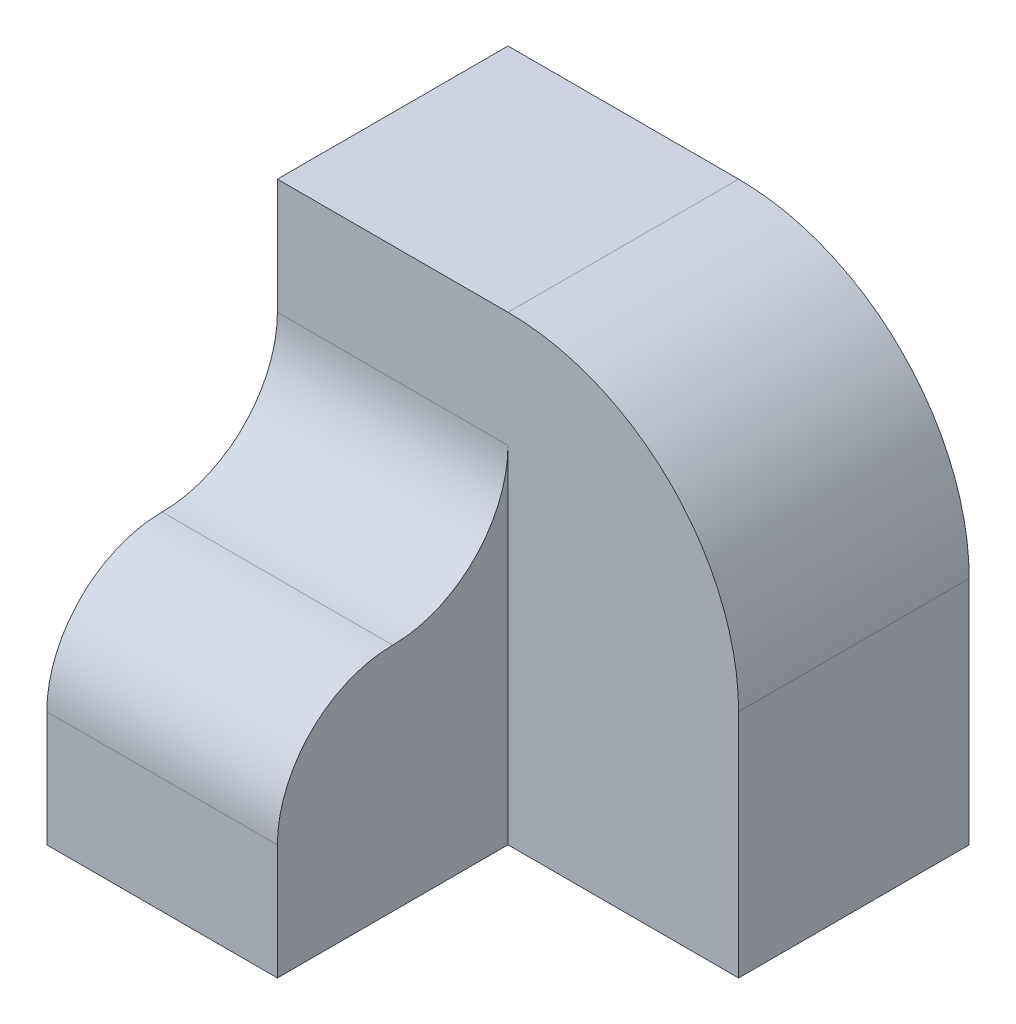
from build123d import *

# Parameters (mm, degrees)
DODANIE_WYCI_GNI_CIE1_DEPTH = 20
SZKIC2_W                    = 20
SZKIC2_H                    = 40
DODANIE_WYCI_GNI_CIE2_DEPTH = 20
WYTNIJ_WYCI_GNI_CIE1_DEPTH  = 20
ZAOKR_GLENIE1_R             = 10
ZAOKR_GLENIE2_R             = 10


with BuildPart() as part:
    # Szkic1 → Dodanie-wyciągnięcie1 (new body)
    with BuildSketch(Plane.XY):
        with BuildLine():
            Line((0, 0), (40, 0))
            Line((40, 0), (40, 20))
            ThreePointArc((40, 20), (34.142135624, 34.142135624), (20, 40))
            Line((20, 40), (0, 40))
            Line((0, 40), (0, 0))
        make_face()
    extrude(amount=DODANIE_WYCI_GNI_CIE1_DEPTH)

    # Szkic2 → Dodanie-wyciągnięcie2 (add)
    with BuildSketch(Plane.XY.offset(20)):
        with Locations((10, 20)):
            Rectangle(SZKIC2_W, SZKIC2_H)
    extrude(amount=DODANIE_WYCI_GNI_CIE2_DEPTH)

    # Szkic3 → Wytnij-wyciągnięcie1 (cut)
    with BuildSketch(Plane(origin=(20, 0, 0), x_dir=(0, 0, -1), z_dir=(1, 0, 0))):
        Polygon((-40, 20), (-30, 20), (-20, 20), (-20, 40), (-40, 40), align=None)
    extrude(amount=-WYTNIJ_WYCI_GNI_CIE1_DEPTH, mode=Mode.SUBTRACT)

    # Zaokrąglenie1
    zaokr_glenie1_edges = [part.edges().sort_by_distance(p)[0] for p in [
        (10, 20, 20),
    ]]
    fillet(zaokr_glenie1_edges, radius=ZAOKR_GLENIE1_R)

    # Zaokrąglenie2
    zaokr_glenie2_edges = [part.edges().sort_by_distance(p)[0] for p in [
        (10, 20, 40),
    ]]
    fillet(zaokr_glenie2_edges, radius=ZAOKR_GLENIE2_R - 0.0001)  # a hair under: the kernel refuses the full size


solid = part.part
